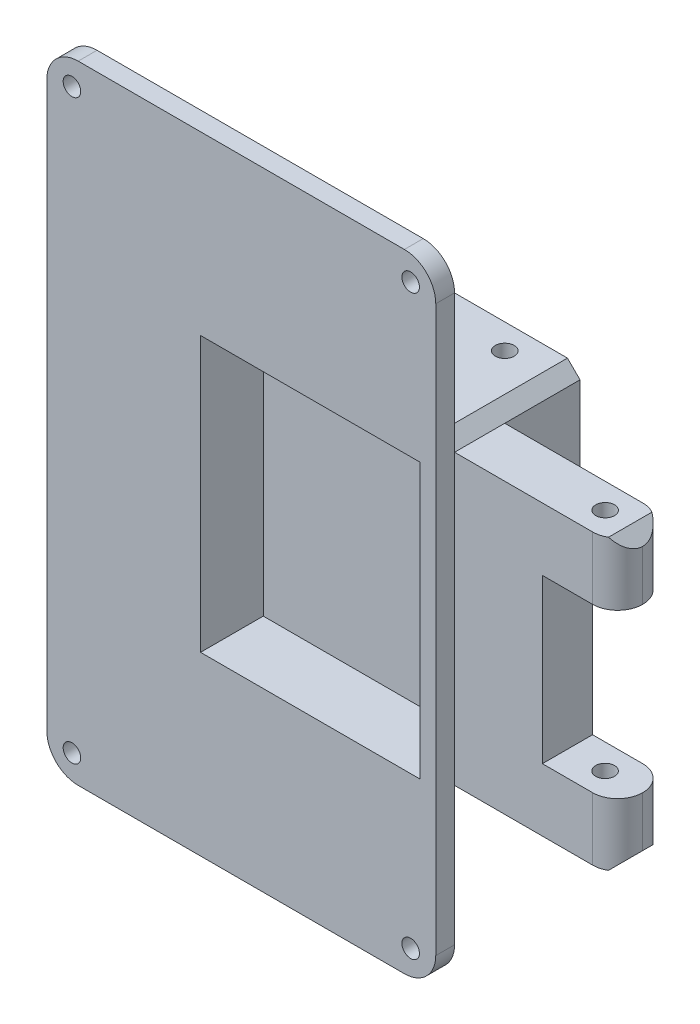
from build123d import *

# Parameters (mm, degrees)
SKETCH_1_W                      = 40
SKETCH_1_H                      = 50
SKETCH_1_W_2                    = 35
SKETCH_1_H_2                    = 43.75
EXTRUDE_1_DEPTH                 = 20
CHAMFER_1_SIZE                  = 2
SKETCH_4_R                      = 1.5
CUT_EXTRUDE_3_DEPTH             = 6
SKETCH_7_W                      = 8
SKETCH_7_H                      = 46
EXTRUDE_2_DEPTH                 = 26
SKETCH_8_W                      = 8
SKETCH_8_H                      = 26
CUT_EXTRUDE_5_DEPTH             = 12
CHAMFER_2_SIZE                  = 2
FILLET_1_R                      = 4
CUT_EXTRUDE_6_DEPTH             = 70.426219831
CUT_EXTRUDE_6_DEPTH_BACK        = 70.426219831
SKETCH_9_R                      = 1.5
SKETCH_10_W                     = 35
SKETCH_10_H                     = 43.75
EXTRUDE_4_DEPTH                 = 2
SKETCH_11_W                     = 62
SKETCH_11_H                     = 100
SKETCH_11_R                     = 1.4
SKETCH_11_W_2                   = 35
SKETCH_11_H_2                   = 43.75
EXTRUDE_5_DEPTH                 = 3
FILLET_2_R                      = 5
SKETCH_12_W                     = 35
SKETCH_12_H                     = 43.75
EXTRUDE_6_DEPTH                 = 11
CUT_EXTRUDE_4_REACH             = 92.94
SKETCH_5_R                      = 1.5
CUT_EXTRUDE_4_DIRECTION_2_DEPTH = 91.939540355


with BuildPart() as part:
    # 草图1 → 凸台-拉伸1 (new body)
    with BuildSketch(Plane.XY):
        Rectangle(SKETCH_1_W, SKETCH_1_H)
        Rectangle(SKETCH_1_W_2, SKETCH_1_H_2, mode=Mode.SUBTRACT)
    extrude(amount=EXTRUDE_1_DEPTH)

    # 倒角1
    chamfer_1_edges = [part.edges().sort_by_distance(p)[0] for p in [
        (20, -25, 10),
        (-20, -25, 10),
        (-20, 25, 10),
        (20, 25, 10),
    ]]
    chamfer(chamfer_1_edges, length=CHAMFER_1_SIZE)

    # 草图4 → 切除-拉伸3 (cut)
    with BuildSketch(Plane(origin=(0, 25, 0), x_dir=(1, 0, 0), z_dir=(0, 1, 0))):
        with Locations(Location((-12, -4, 0), (0, 0, 270))):
            Circle(SKETCH_4_R)
        with Locations(Location((0, -4, 0), (0, 0, 270))):
            Circle(SKETCH_4_R)
        with Locations(Location((12, -4, 0), (0, 0, 270))):
            Circle(SKETCH_4_R)
    extrude(amount=-CUT_EXTRUDE_3_DEPTH, mode=Mode.SUBTRACT)

    # 草图7 → 凸台-拉伸2 (add)
    with BuildSketch(Plane(origin=(20, 0, 0), x_dir=(0, 0, -1), z_dir=(1, 0, 0))):
        with Locations((-16, 0)):
            Rectangle(SKETCH_7_W, SKETCH_7_H)
    extrude(amount=EXTRUDE_2_DEPTH)

    # 草图8 → 切除-拉伸5 (cut)
    with BuildSketch(Plane(origin=(46, 0, 0), x_dir=(0, 0, -1), z_dir=(1, 0, 0))):
        with Locations((-16, 0)):
            Rectangle(SKETCH_8_W, SKETCH_8_H)
    extrude(amount=-CUT_EXTRUDE_5_DEPTH, mode=Mode.SUBTRACT)

    # 倒角2
    chamfer_2_edges = [part.edges().sort_by_distance(p)[0] for p in [
        (46, -23, 16),
        (46, 23, 16),
    ]]
    chamfer(chamfer_2_edges, length=CHAMFER_2_SIZE)

    # 圆角1
    fillet_1_edges = [part.edges().sort_by_distance(p)[0] for p in [
        (46, -17, 12),
        (46, -17, 20),
        (46, 17, 12),
        (46, 17, 20),
    ]]
    fillet(fillet_1_edges, radius=FILLET_1_R - 0.0001)  # a hair under: the kernel refuses the full size

    # 草图9 → 切除-拉伸6 (cut, two sides: drawn at the far end of the back side and taken through both)
    with BuildSketch(Plane.XZ.offset(23).offset(-CUT_EXTRUDE_6_DEPTH_BACK)):
        with Locations((40, 16)):
            Circle(SKETCH_9_R)
    extrude(amount=CUT_EXTRUDE_6_DEPTH + CUT_EXTRUDE_6_DEPTH_BACK, mode=Mode.SUBTRACT)

    # 草图10 → 凸台-拉伸4 (add)
    with BuildSketch(Plane(origin=(0, 0, 0), x_dir=(-1, 0, 0), z_dir=(0, 0, -1))):
        Rectangle(SKETCH_10_W, SKETCH_10_H)
    extrude(amount=-EXTRUDE_4_DEPTH)

    # 草图11 → 凸台-拉伸5 (add)
    with BuildSketch(Plane.XY.offset(20)):
        with Locations((-11, 0)):
            Rectangle(SKETCH_11_W, SKETCH_11_H)
        with Locations((-38, 46)):
            Circle(SKETCH_11_R, mode=Mode.SUBTRACT)
        with Locations((16, 46)):
            Circle(SKETCH_11_R, mode=Mode.SUBTRACT)
        with Locations((-38, -46)):
            Circle(SKETCH_11_R, mode=Mode.SUBTRACT)
        with Locations((16, -46)):
            Circle(SKETCH_11_R, mode=Mode.SUBTRACT)
        Rectangle(SKETCH_11_W_2, SKETCH_11_H_2, mode=Mode.SUBTRACT)
    extrude(amount=EXTRUDE_5_DEPTH)

    # 圆角2
    fillet_2_edges = [part.edges().sort_by_distance(p)[0] for p in [
        (20, -50, 21.5),
        (20, 50, 21.5),
        (-42, 50, 21.5),
        (-42, -50, 21.5),
    ]]
    fillet(fillet_2_edges, radius=FILLET_2_R)

    # 草图12 → 凸台-拉伸6 (add)
    with BuildSketch(Plane.XY.offset(2)):
        Rectangle(SKETCH_12_W, SKETCH_12_H)
    extrude(amount=EXTRUDE_6_DEPTH)

    # 草图5 → 切除-拉伸4 (cut, up to next)
    with BuildSketch(Plane.XZ.offset(25), mode=Mode.PRIVATE) as cut_extrude_4_sk1:
        with Locations(Location((-12, 4, 0), (0, 0, 90))):
            Circle(SKETCH_5_R)
    cut_extrude_4_tool1 = extrude(cut_extrude_4_sk1.sketch, amount=-CUT_EXTRUDE_4_REACH, mode=Mode.PRIVATE) & part.part
    # 草图5 → 切除-拉伸4 (cut, up to next)
    with BuildSketch(Plane.XZ.offset(25), mode=Mode.PRIVATE) as cut_extrude_4_sk2:
        with Locations(Location((0, 4, 0), (0, 0, 90))):
            Circle(SKETCH_5_R)
    cut_extrude_4_tool2 = extrude(cut_extrude_4_sk2.sketch, amount=-CUT_EXTRUDE_4_REACH, mode=Mode.PRIVATE) & part.part
    # 草图5 → 切除-拉伸4 (cut, up to next)
    with BuildSketch(Plane.XZ.offset(25), mode=Mode.PRIVATE) as cut_extrude_4_sk3:
        with Locations(Location((12, 4, 0), (0, 0, 90))):
            Circle(SKETCH_5_R)
    cut_extrude_4_tool3 = extrude(cut_extrude_4_sk3.sketch, amount=-CUT_EXTRUDE_4_REACH, mode=Mode.PRIVATE) & part.part
    add(cut_extrude_4_tool1.solids().sort_by_distance((-12, -25, 4))[0], mode=Mode.SUBTRACT)
    add(cut_extrude_4_tool2.solids().sort_by_distance((0, -25, 4))[0], mode=Mode.SUBTRACT)
    add(cut_extrude_4_tool3.solids().sort_by_distance((12, -25, 4))[0], mode=Mode.SUBTRACT)

    # 草图5 → 切除-拉伸4 direction 2 (cut)
    with BuildSketch(Plane.XZ.offset(25)):
        with Locations(Location((-12, 4, 0), (0, 0, 90))):
            Circle(SKETCH_5_R)
        with Locations(Location((0, 4, 0), (0, 0, 90))):
            Circle(SKETCH_5_R)
        with Locations(Location((12, 4, 0), (0, 0, 90))):
            Circle(SKETCH_5_R)
    extrude(amount=CUT_EXTRUDE_4_DIRECTION_2_DEPTH, mode=Mode.SUBTRACT)


solid = part.part
